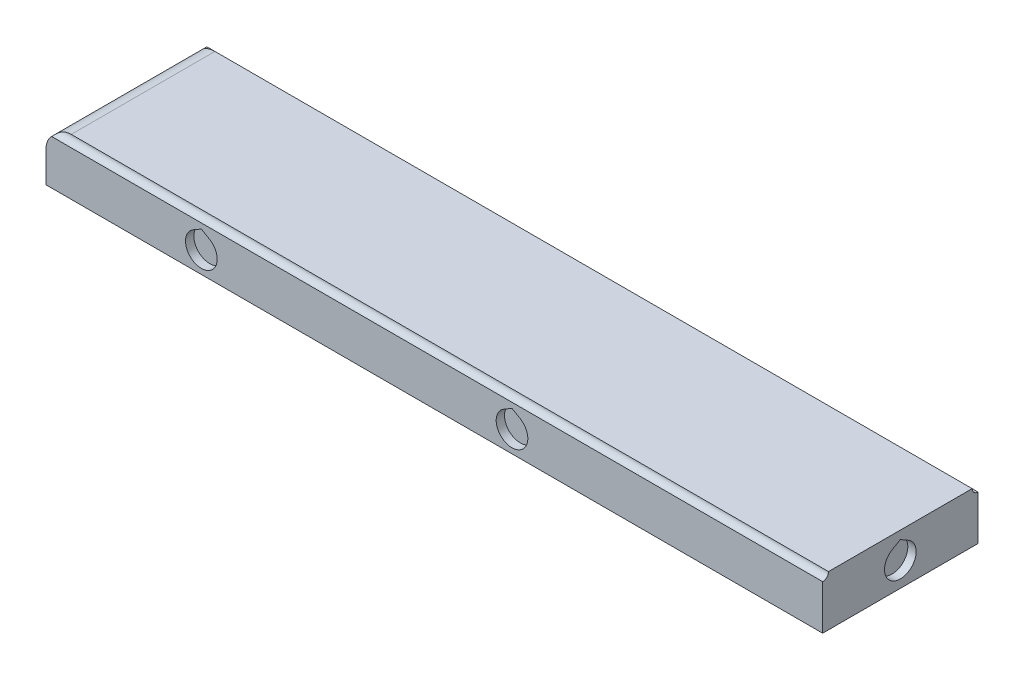
from build123d import *

# Parameters (mm, degrees)
SKETCH_1_W                         = 200
SKETCH_1_H                         = 40
EXTRUDE_1_DEPTH                    = 13
SWEEP_START                        = -100
SWEEP_1_DEPTH                      = 200
SWEEP_2_DEPTH                      = 200
SKETCH_16_R                        = 4.075
CUT_EXTRUDE_1_DEPTH                = 2.15
PATTERN_LINEAR_1_COUNT             = 2
PATTERN_LINEAR_1_PITCH             = 80
PATTERN_CIRCULAR_1_COUNT           = 2
PATTERN_CIRCULAR_1_COPY_1_SKETCH_R = 4.075
PATTERN_CIRCULAR_1_COPY_1_DEPTH    = 2.15
SKETCH_20_R                        = 4.075
CUT_EXTRUDE_2_DEPTH                = 2.15
FILLET_1_R                         = 5


# Read off the part's stored shape, not the designer's step: Вырез-По траектории1, Вырез-По траектории2
with BuildPart() as part:
    # Эскиз1 → Бобышка-Вытянуть1 (new body)
    with BuildSketch(Plane(origin=(0, 0, 0), x_dir=(1, 0, 0), z_dir=(0, 1, 0))):
        Rectangle(SKETCH_1_W, SKETCH_1_H)
    extrude(amount=-EXTRUDE_1_DEPTH)

    # Вырез-По траектории1 outline → Вырез-По траектории1 (cut)
    with BuildSketch(Plane.YZ.offset(SWEEP_START)):
        with BuildLine():
            Line((0, 20), (-1.5, 20))
            ThreePointArc((-1.5, 20), (-1.060660172, 18.939339828), (0, 18.5))
            Line((0, 18.5), (0, 20))
        make_face()
    extrude(amount=SWEEP_1_DEPTH, mode=Mode.SUBTRACT)

    # Вырез-По траектории2 outline → Вырез-По траектории2 (cut)
    with BuildSketch(Plane.YZ.offset(SWEEP_START)):
        with BuildLine():
            ThreePointArc((0, -18.5), (-1.060660172, -18.939339828), (-1.5, -20))
            Line((-1.5, -20), (0, -20))
            Line((0, -20), (0, -18.5))
        make_face()
    extrude(amount=SWEEP_2_DEPTH, mode=Mode.SUBTRACT)

    # Эскиз16 → Вырез-Вытянуть1 (cut)
    with BuildSketch(Plane(origin=(0, 0, -20), x_dir=(-1, 0, 0), z_dir=(0, 0, -1))):
        with Locations((-60, -7.565202347)):
            Circle(SKETCH_16_R)
        with BuildLine():
            Line((-60, -2.859797653), (-62.0375, -4.036148827))
            ThreePointArc((-62.0375, -4.036148827), (-60, -3.490202347), (-57.9625, -4.036148827))
            Line((-57.9625, -4.036148827), (-60, -2.859797653))
        make_face()
    cut_extrude_1 = extrude(amount=-CUT_EXTRUDE_1_DEPTH, mode=Mode.SUBTRACT)

    # Линейный массив1: Вырез-Вытянуть1 ×2
    with Locations(*[(-i * PATTERN_LINEAR_1_PITCH, 0, 0) for i in range(1, PATTERN_LINEAR_1_COUNT)]):
        add(cut_extrude_1, mode=Mode.SUBTRACT)

    # Круговой массив1: Вырез-Вытянуть1 ×2 about axis
    pattern_circular_1_axis = Axis((0, -13, 0), (0, -1, 0))
    for i in range(1, PATTERN_CIRCULAR_1_COUNT):
        add(cut_extrude_1.rotate(pattern_circular_1_axis, i * 360 / PATTERN_CIRCULAR_1_COUNT), mode=Mode.SUBTRACT)

    # Круговой массив1 copy 1 sketch → Круговой массив1 copy 1 (cut)
    with BuildSketch(Plane(origin=(80, 0, 20), x_dir=(1, 0, 0), z_dir=(0, 0, 1))):
        with Locations((-60, -7.565202347)):
            Circle(PATTERN_CIRCULAR_1_COPY_1_SKETCH_R)
        with BuildLine():
            Line((-60, -2.859797653), (-62.0375, -4.036148827))
            ThreePointArc((-62.0375, -4.036148827), (-60, -3.490202347), (-57.9625, -4.036148827))
            Line((-57.9625, -4.036148827), (-60, -2.859797653))
        make_face()
    extrude(amount=-PATTERN_CIRCULAR_1_COPY_1_DEPTH, mode=Mode.SUBTRACT)

    # Эскиз20 → Вырез-Вытянуть2 (cut)
    with BuildSketch(Plane.ZY.offset(-100)):
        with Locations((0, -6.815202347)):
            Circle(SKETCH_20_R)
        with BuildLine():
            Line((2.0375, -3.286148827), (0, -2.109797653))
            Line((0, -2.109797653), (-2.0375, -3.286148827))
            ThreePointArc((-2.0375, -3.286148827), (0, -2.740202347), (2.0375, -3.286148827))
        make_face()
    extrude(amount=CUT_EXTRUDE_2_DEPTH, mode=Mode.SUBTRACT)

    # Скругление1
    fillet_1_edges = [part.edges().sort_by_distance(p)[0] for p in [
        (-100, 0, 0),
    ]]
    fillet(fillet_1_edges, radius=FILLET_1_R)


solid = part.part
